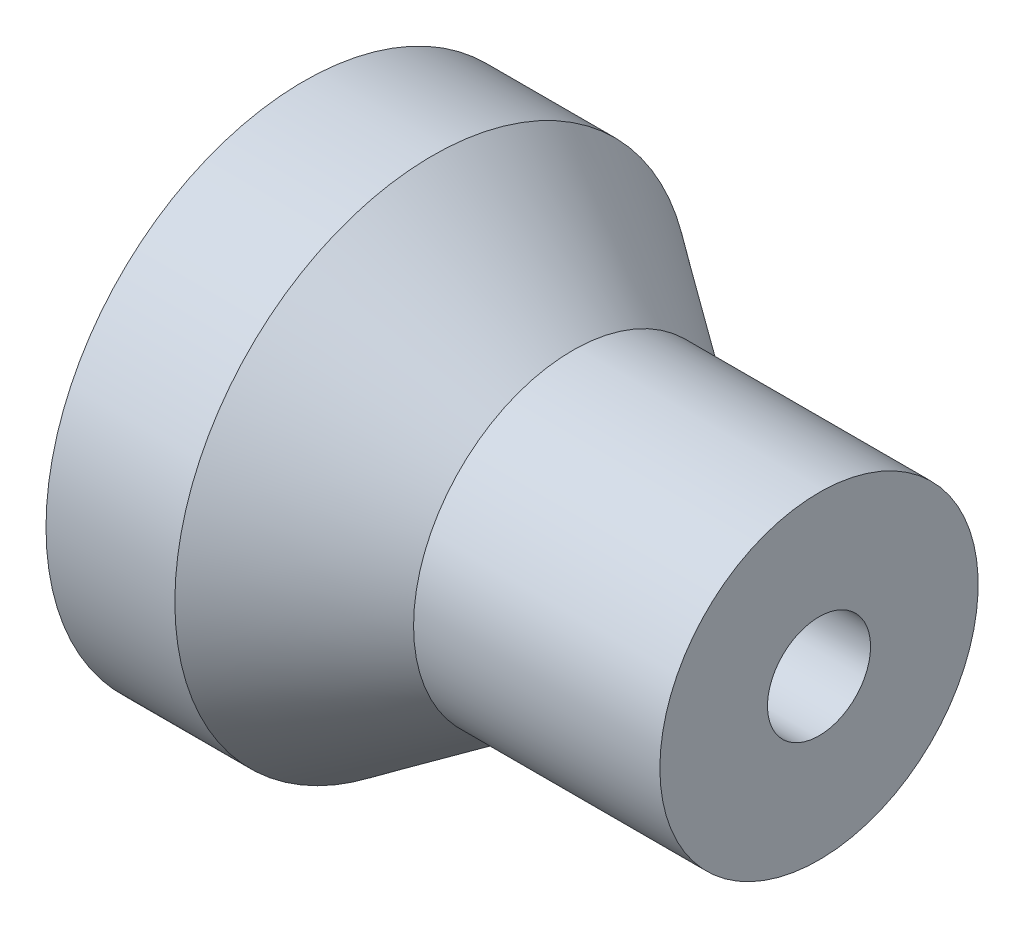
from build123d import *

# Parameters (mm, degrees)
SKETCH2_R          = 2
CUT_EXTRUDE2_DEPTH = 18
SKETCH3_R          = 4.5
CUT_EXTRUDE3_DEPTH = 2
CHAMFER2_SIZE      = 3


with BuildPart() as part:
    # Sketch1 → Revolve1 (revolve)
    with BuildSketch(Plane(origin=(0, 0, 0), x_dir=(1, 0, 0), z_dir=(0, 1, 0)), mode=Mode.PRIVATE) as revolve1_sk:
        Polygon((-30.147058824, 0), (-30.147058824, 10), (-25.147058824, 10), (-19.705882353, 6.176470588), (-10.147058824, 6.176470588), (-10.147058824, 0), align=None)
    revolve(revolve1_sk.sketch.rotate(Axis((-68.088235294, 0, 0), (1, 0, 0)), 180), axis=Axis((-68.088235294, 0, 0), (1, 0, 0)))

    # Sketch2 → Cut-Extrude2 (cut)
    with BuildSketch(Plane(origin=(-10.147058824, 0, 0), x_dir=(0, 0, -1), z_dir=(1, 0, 0))):
        Circle(SKETCH2_R)
    extrude(amount=-CUT_EXTRUDE2_DEPTH, mode=Mode.SUBTRACT)

    # Sketch3 → Cut-Extrude3 (cut)
    with BuildSketch(Plane.ZY.offset(30.147058824)):
        Circle(SKETCH3_R)
    extrude(amount=-CUT_EXTRUDE3_DEPTH, mode=Mode.SUBTRACT)

    # Chamfer2
    # the kernel refuses this chamfer: 3 mm, written as the material it takes off along each edge
    with BuildSketch(Plane(origin=(-28.147058824, 0, 0), x_dir=(0, 0, -1), z_dir=(0, -1, 0))) as chamfer2_piece_1_section:
        Polygon((2 + CHAMFER2_SIZE, 0), (2, CHAMFER2_SIZE), (2, 0), align=None)
    chamfer2_piece_1 = revolve(axis=Axis((-28.147058824, 0, 0), (1, 0, 0)), mode=Mode.PRIVATE)
    chamfer2_piece_1 = chamfer2_piece_1 & Plane(origin=(-26.385999782, 0, 0), x_dir=(0, 0, 1), z_dir=(-1, 0, 0)) * Cylinder(4.5, 20, mode=Mode.PRIVATE)
    add(chamfer2_piece_1, mode=Mode.SUBTRACT)


solid = part.part
